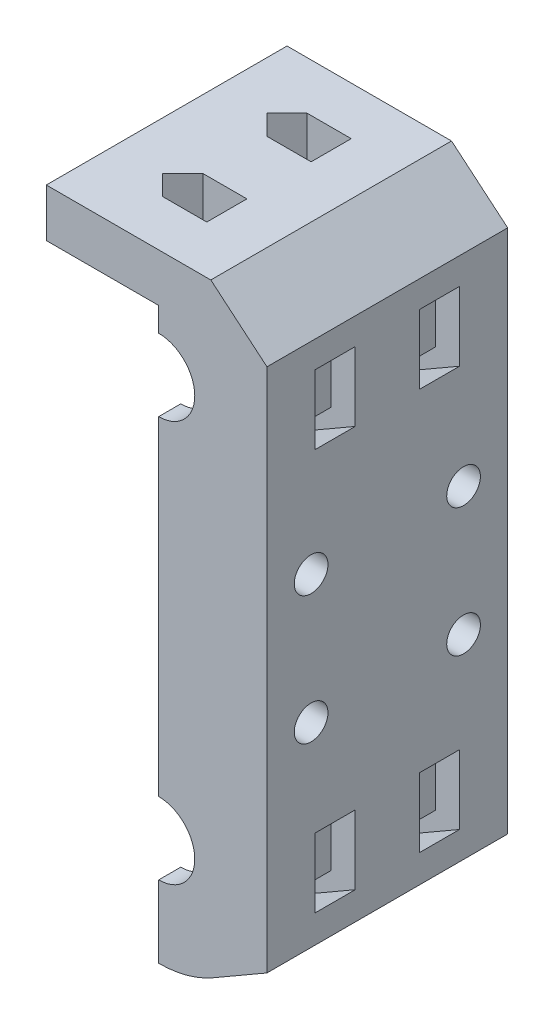
from build123d import *

# Parameters (mm, degrees)
BOSS_EXTRUDE1_DEPTH     = 15
BOSS_EXTRUDE2_DEPTH     = 2.75
CUT_EXTRUDE1_START      = -6
CUT_EXTRUDE1_DEPTH      = 5
SKETCH5_W               = 5
SKETCH5_H               = 8.618802154
CUT_EXTRUDE2_DEPTH      = 3
MIRROR5_START           = -6
MIRROR5_COPY_1_DEPTH    = 5
MIRROR5_COPY_2_SKETCH_W = 5
MIRROR5_COPY_2_SKETCH_H = 8.618802154
MIRROR5_COPY_2_DEPTH    = 3
SKETCH6_R               = 2.1
CUT_EXTRUDE3_DEPTH      = 44.468379312
LPATTERN2_COUNT         = 2
LPATTERN2_PITCH         = 16
BOSS_EXTRUDE3_DEPTH     = 30
SKETCH9_W               = 8
SKETCH9_H               = 6
SKETCH9_W_2             = 6
BOSS_EXTRUDE4_DEPTH     = 14
SKETCH10_W              = 30
SKETCH10_H              = 6
BOSS_EXTRUDE5_DEPTH     = 6
CHAMFER1_SIZE           = 2.5
CHAMFER2_SIZE           = 7
CHAMFER2_SIZE2          = 5.873697418


with BuildPart() as part:
    # Sketch1 → Boss-Extrude1 (new, symmetric)
    with BuildSketch(Plane.XY):
        with BuildLine():
            Line((13.5, -25), (13.5, 25))
            Line((13.5, 25), (13.5, 32.794228634))
            Line((13.5, 32.794228634), (6.75, 36.691342951))
            ThreePointArc((6.75, 36.691342951), (3.494057109, 38.039998655), (0, 38.5))
            Line((0, 38.5), (0, 32.5))
            ThreePointArc((0, 32.5), (7.5, 25), (0, 17.5))
            Line((0, 17.5), (0, -17.5))
            ThreePointArc((0, -17.5), (7.5, -25), (0, -32.5))
            Line((0, -32.5), (0, -38.5))
            ThreePointArc((0, -38.5), (3.494057109, -38.039998655), (6.75, -36.691342951))
            Line((6.75, -36.691342951), (13.5, -32.794228634))
            Line((13.5, -32.794228634), (13.5, -25))
        make_face()
    extrude(amount=BOSS_EXTRUDE1_DEPTH, both=True)

    # Sketch2 → Boss-Extrude2 (add)
    with BuildSketch(Plane.XY.offset(15)):
        with BuildLine():
            Line((0, 32.5), (0, 29.5))
            ThreePointArc((0, 29.5), (4.5, 25), (0, 20.5))
            Line((0, 20.5), (0, 17.5))
            ThreePointArc((0, 17.5), (7.5, 25), (0, 32.5))
        make_face()
        with BuildLine():
            Line((0, -17.5), (0, -20.5))
            ThreePointArc((0, -20.5), (4.5, -25), (0, -29.5))
            Line((0, -29.5), (0, -32.5))
            ThreePointArc((0, -32.5), (7.5, -25), (0, -17.5))
        make_face()
    boss_extrude2 = extrude(amount=-BOSS_EXTRUDE2_DEPTH)

    # Mirror1: Boss-Extrude2 across plane
    add(boss_extrude2.mirror(Plane.XY))

    # Sketch3 → Cut-Extrude1 (cut)
    with BuildSketch(Plane.XY.offset(15).offset(CUT_EXTRUDE1_START)):
        with BuildLine():
            Line((0, 34.5), (0, 36.5))
            ThreePointArc((0, 36.5), (1.009892189, 36.367045171), (1.950961894, 35.977241336))
            Line((1.950961894, 35.977241336), (13.5, 29.309401077))
            Line((13.5, 29.309401077), (13.5, 27))
            Line((13.5, 27), (0.950961894, 34.245190528))
            ThreePointArc((0.950961894, 34.245190528), (0.492254099, 34.435193518), (0, 34.5))
        make_face()
        with BuildLine():
            Line((13.5, 23), (0.950961894, 15.754809472))
            ThreePointArc((0.950961894, 15.754809472), (0.492254099, 15.564806482), (0, 15.5))
            Line((0, 15.5), (0, 13.5))
            ThreePointArc((0, 13.5), (1.009892189, 13.632954829), (1.950961894, 14.022758664))
            Line((1.950961894, 14.022758664), (13.5, 20.690598923))
            Line((13.5, 20.690598923), (13.5, 23))
        make_face()
    cut_extrude1 = extrude(amount=-CUT_EXTRUDE1_DEPTH, mode=Mode.SUBTRACT)

    # Sketch5 → Cut-Extrude2 (cut)
    with BuildSketch(Plane(origin=(13.5, 0, 0), x_dir=(0, 0, -1), z_dir=(1, 0, 0))):
        with Locations((-6.5, 25)):
            Rectangle(SKETCH5_W, SKETCH5_H)
    cut_extrude2 = extrude(amount=-CUT_EXTRUDE2_DEPTH, mode=Mode.SUBTRACT)

    # Mirror3: Cut-Extrude1, Cut-Extrude2 across plane
    add(cut_extrude1.mirror(Plane.XY), mode=Mode.SUBTRACT)
    add(cut_extrude2.mirror(Plane.XY), mode=Mode.SUBTRACT)

    # Mirror5: Cut-Extrude1, Cut-Extrude2 across plane
    add(cut_extrude1.mirror(Plane.ZX), mode=Mode.SUBTRACT)
    add(cut_extrude2.mirror(Plane.ZX), mode=Mode.SUBTRACT)

    # Mirror5 copy 1 sketch → Mirror5 copy 1 (cut)
    with BuildSketch(Plane(origin=(0, 0, -15), x_dir=(1, 0, 0), z_dir=(0, 0, -1)).offset(MIRROR5_START)):
        with BuildLine():
            Line((0, 34.5), (0, 36.5))
            ThreePointArc((0, 36.5), (1.009892189, 36.367045171), (1.950961894, 35.977241336))
            Line((1.950961894, 35.977241336), (13.5, 29.309401077))
            Line((13.5, 29.309401077), (13.5, 27))
            Line((13.5, 27), (0.950961894, 34.245190528))
            ThreePointArc((0.950961894, 34.245190528), (0.492254099, 34.435193518), (0, 34.5))
        make_face()
        with BuildLine():
            Line((13.5, 23), (0.950961894, 15.754809472))
            ThreePointArc((0.950961894, 15.754809472), (0.492254099, 15.564806482), (0, 15.5))
            Line((0, 15.5), (0, 13.5))
            ThreePointArc((0, 13.5), (1.009892189, 13.632954829), (1.950961894, 14.022758664))
            Line((1.950961894, 14.022758664), (13.5, 20.690598923))
            Line((13.5, 20.690598923), (13.5, 23))
        make_face()
    extrude(amount=-MIRROR5_COPY_1_DEPTH, mode=Mode.SUBTRACT)

    # Mirror5 copy 2 sketch → Mirror5 copy 2 (cut)
    with BuildSketch(Plane(origin=(13.5, 0, 0), x_dir=(0, 0, 1), z_dir=(1, 0, 0))):
        with Locations((-6.5, 25)):
            Rectangle(MIRROR5_COPY_2_SKETCH_W, MIRROR5_COPY_2_SKETCH_H)
    extrude(amount=-MIRROR5_COPY_2_DEPTH, mode=Mode.SUBTRACT)

    # Sketch6 → Cut-Extrude3 (cut, through all)
    with BuildSketch(Plane(origin=(13.5, 0, 0), x_dir=(0, 0, -1), z_dir=(1, 0, 0))):
        with Locations(Location((-9.5, -8.5, 0), (0, 0, 90))):
            Circle(SKETCH6_R)
        with Locations(Location((9.5, -8.5, 0), (0, 0, 90))):
            Circle(SKETCH6_R)
    cut_extrude3 = extrude(amount=-CUT_EXTRUDE3_DEPTH, mode=Mode.SUBTRACT)

    # LPattern2: Cut-Extrude3 ×2
    with Locations(*[(0, i * LPATTERN2_PITCH, 0) for i in range(1, LPATTERN2_COUNT)]):
        add(cut_extrude3, mode=Mode.SUBTRACT)

    # Sketch8 → Boss-Extrude3 (add)
    with BuildSketch(Plane.XY.offset(15)):
        with BuildLine():
            Line((0, 38.5), (13.5, 38.5))
            Line((13.5, 38.5), (13.5, 32.794228634))
            Line((13.5, 32.794228634), (6.75, 36.691342951))
            ThreePointArc((6.75, 36.691342951), (3.494057109, 38.039998655), (0, 38.5))
        make_face()
    extrude(amount=-BOSS_EXTRUDE3_DEPTH)

    # Sketch9 → Boss-Extrude4 (add)
    with BuildSketch(Plane.ZY):
        with Locations((0, 35.5)):
            Rectangle(SKETCH9_W, SKETCH9_H)
        with Locations((12, 35.5)):
            Rectangle(SKETCH9_W_2, SKETCH9_H)
        with Locations((-12, 35.5)):
            Rectangle(SKETCH9_W_2, SKETCH9_H)
    extrude(amount=BOSS_EXTRUDE4_DEPTH)

    # Sketch10 → Boss-Extrude5 (add)
    with BuildSketch(Plane.ZY.offset(14)):
        with Locations((0, 35.5)):
            Rectangle(SKETCH10_W, SKETCH10_H)
    extrude(amount=-BOSS_EXTRUDE5_DEPTH)

    # Chamfer1
    chamfer1_edges = [part.edges().sort_by_distance(p)[0] for p in [
        (-8, 35.5, 4),
        (-8, 35.5, 9),
        (-8, 35.5, -4),
        (-8, 35.5, -9),
    ]]
    chamfer(chamfer1_edges, length=CHAMFER1_SIZE - 0.0001)  # a hair under: the kernel refuses the full size

    # Chamfer2
    chamfer2_edges = [part.edges().sort_by_distance(p)[0] for p in [
        (13.5, 38.5, 0),
    ]]
    chamfer2_side = [part.faces().sort_by_distance(p)[0] for p in [
        (0.031912143, 38.5, 0),
    ]]
    chamfer(chamfer2_edges, length=CHAMFER2_SIZE, length2=CHAMFER2_SIZE2, reference=chamfer2_side[0])


solid = part.part
